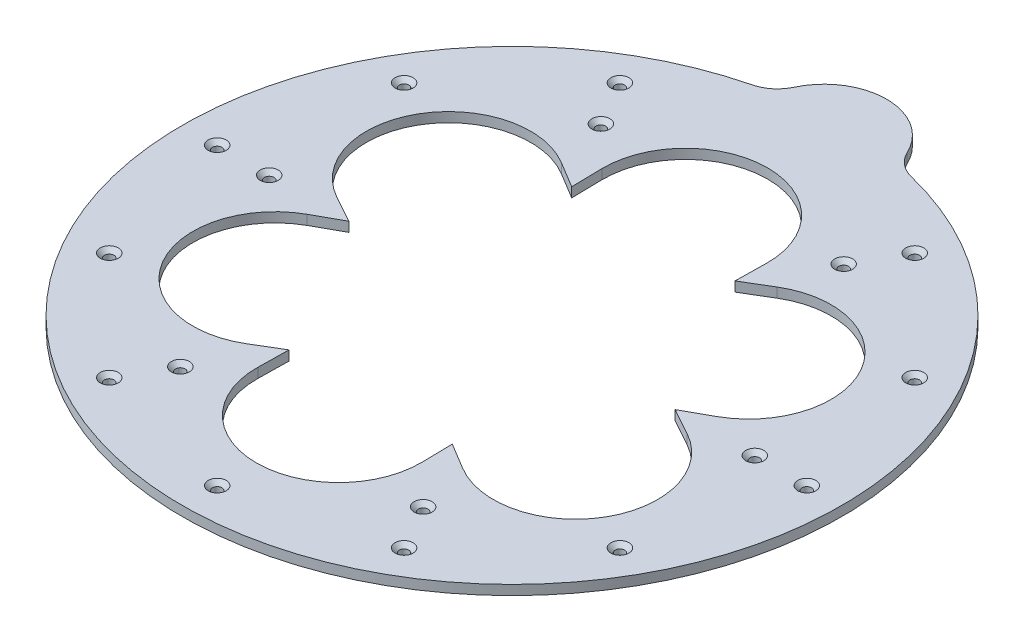
from build123d import *

# Parameters (mm, degrees)
BOSS_EXTRUDE3_DEPTH                             = 5.6
CSK_FOR_M5_FLAT_HEAD_MACHINE_SCREW1_D           = 5.5
CSK_FOR_M5_FLAT_HEAD_MACHINE_SCREW1_CSINK_D     = 10.4
CSK_FOR_M5_FLAT_HEAD_MACHINE_SCREW1_CSINK_ANGLE = 90
CIRPATTERN1_COUNT                               = 12
CSK_FOR_M5_FLAT_HEAD_MACHINE_SCREW2_D           = 5.5
CSK_FOR_M5_FLAT_HEAD_MACHINE_SCREW2_CSINK_D     = 10.4
CSK_FOR_M5_FLAT_HEAD_MACHINE_SCREW2_CSINK_ANGLE = 90
CIRPATTERN2_COUNT                               = 6


with BuildPart() as part:
    # Sketch5 → Boss-Extrude3 (new body)
    with BuildSketch(Plane(origin=(0, 0, 0), x_dir=(1, 0, 0), z_dir=(0, 1, 0))):
        with BuildLine():
            ThreePointArc((-45.876558414, 184.378256278), (0.010243817, -189.999999724), (45.856676704, 184.383202059))
            ThreePointArc((45.856676704, 184.383202059), (37.985823171, 188.339968607), (32.578557994, 195.294666309))
            ThreePointArc((32.578557994, 195.294666309), (-0.011645544, 215.998911827), (-32.599616361, 195.291152239))
            ThreePointArc((-32.599616361, 195.291152239), (-38.006131584, 188.335871514), (-45.876558414, 184.378256278))
        make_face()
        with BuildLine():
            Line((-47.367120943, -99.136010081), (-47.045154091, -81.484597135))
            Line((-47.045154091, -81.484597135), (-62.170742689, -90.589135081))
            ThreePointArc((-62.170742689, -90.589135081), (-127.630493883, -73.6875), (-109.537863632, -8.546875))
            Line((-109.537863632, -8.546875), (-94.090308181, 0))
            Line((-94.090308181, 0), (-109.537863632, 8.546875))
            ThreePointArc((-109.537863632, 8.546875), (-127.630493883, 73.6875), (-62.170742689, 90.589135081))
            Line((-62.170742689, 90.589135081), (-47.045154091, 81.484597135))
            Line((-47.045154091, 81.484597135), (-47.367120943, 99.136010081))
            ThreePointArc((-47.367120943, 99.136010081), (0, 147.375), (47.367120943, 99.136010081))
            Line((47.367120943, 99.136010081), (47.045154091, 81.484597135))
            Line((47.045154091, 81.484597135), (62.170742689, 90.589135081))
            ThreePointArc((62.170742689, 90.589135081), (127.630493883, 73.6875), (109.537863632, 8.546875))
            Line((109.537863632, 8.546875), (94.090308181, 0))
            Line((94.090308181, 0), (109.537863632, -8.546875))
            ThreePointArc((109.537863632, -8.546875), (127.630493883, -73.6875), (62.170742689, -90.589135081))
            Line((62.170742689, -90.589135081), (47.045154091, -81.484597135))
            Line((47.045154091, -81.484597135), (47.367120943, -99.136010081))
            ThreePointArc((47.367120943, -99.136010081), (0, -147.375), (-47.367120943, -99.136010081))
        make_face(mode=Mode.SUBTRACT)
    extrude(amount=-BOSS_EXTRUDE3_DEPTH)

    # CSK for M5 Flat Head Machine Screw1 (through all)
    with Locations(Plane(origin=(0, 0, 68.145612614), x_dir=(1, 0, 0), z_dir=(0, 1, 0))):
        with Locations((-170, 68.145612614)):
            csk_for_m5_flat_head_machine_screw1 = CounterSinkHole(CSK_FOR_M5_FLAT_HEAD_MACHINE_SCREW1_D / 2, CSK_FOR_M5_FLAT_HEAD_MACHINE_SCREW1_CSINK_D / 2, counter_sink_angle=CSK_FOR_M5_FLAT_HEAD_MACHINE_SCREW1_CSINK_ANGLE)

    # CirPattern1: CSK for M5 Flat Head Machine Screw1 ×12 about axis, 1 skipped
    cirpattern1_axis = Axis((0, -5.6, 0), (0, 1, 0))
    add([csk_for_m5_flat_head_machine_screw1.rotate(cirpattern1_axis, i * 360 / CIRPATTERN1_COUNT) for i in range(1, CIRPATTERN1_COUNT) if i not in (9,)], mode=Mode.SUBTRACT)

    # CSK for M5 Flat Head Machine Screw2 (through all)
    with Locations(Plane(origin=(0, 0, 68.145612614), x_dir=(1, 0, 0), z_dir=(0, 1, 0))):
        with Locations((-140, 68.145612614)):
            csk_for_m5_flat_head_machine_screw2 = CounterSinkHole(CSK_FOR_M5_FLAT_HEAD_MACHINE_SCREW2_D / 2, CSK_FOR_M5_FLAT_HEAD_MACHINE_SCREW2_CSINK_D / 2, counter_sink_angle=CSK_FOR_M5_FLAT_HEAD_MACHINE_SCREW2_CSINK_ANGLE)

    # CirPattern2: CSK for M5 Flat Head Machine Screw2 ×6 about axis
    cirpattern2_axis = Axis((0, -5.6, 0), (0, 1, 0))
    for i in range(1, CIRPATTERN2_COUNT):
        add(csk_for_m5_flat_head_machine_screw2.rotate(cirpattern2_axis, i * 360 / CIRPATTERN2_COUNT), mode=Mode.SUBTRACT)


solid = part.part
